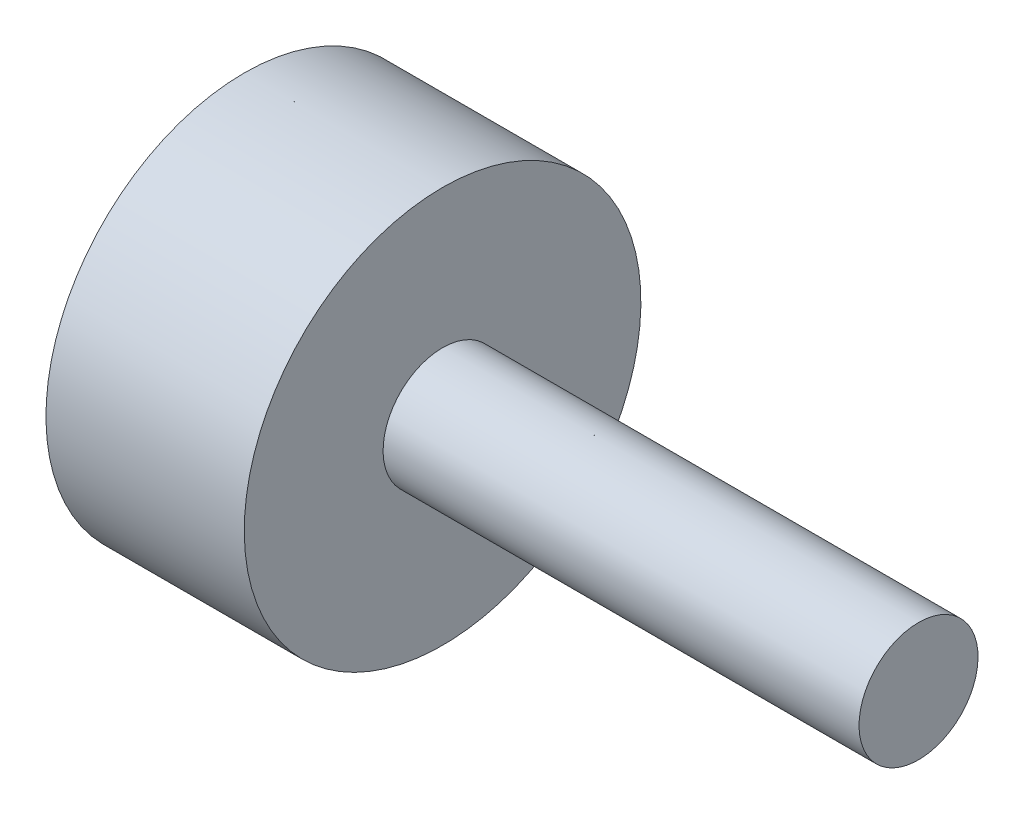
from build123d import *

# Parameters (mm, degrees)
REVOLVE1_ANGLE = 359.999695921


with BuildPart() as part:
    # Sketch1 → Revolve1 (revolve)
    with BuildSketch(Plane.XY):
        Polygon((0, 0), (0, 5), (5, 5), (5, 1.5), (17, 1.5), (17, 0), align=None)
    revolve(axis=Axis((0, 0, 0), (1, 0, 0)), revolution_arc=REVOLVE1_ANGLE)


solid = part.part
